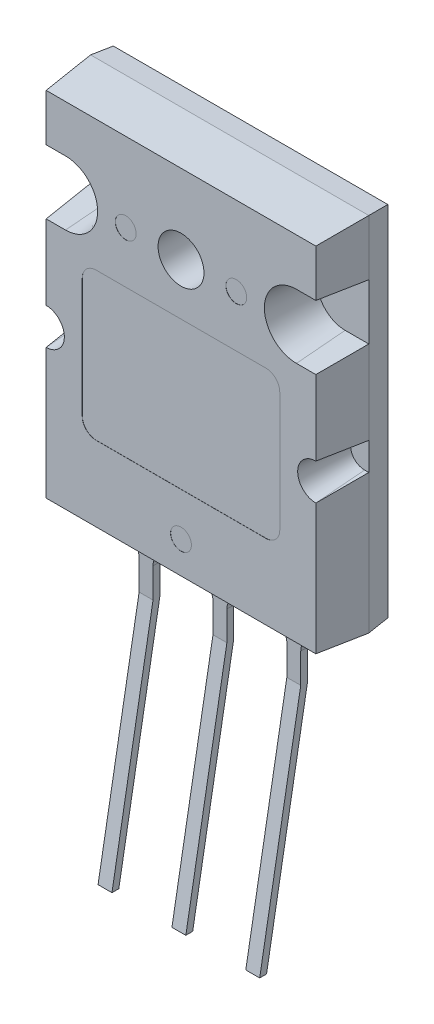
from build123d import *

# Parameters (mm, degrees)
SKETCH1_W                    = 20
SKETCH1_H                    = 26
BOSS_EXTRUDE1_DEPTH          = 1.5
BOSS_EXTRUDE1_DRAFT          = -5
SKETCH1_2_W                  = 20
SKETCH1_2_H                  = 26
BOSS_EXTRUDE2_DEPTH          = 3.5
BOSS_EXTRUDE2_TAPER          = 5
CUT_EXTRUDE1_DEPTH           = 3.5
CUT_EXTRUDE1_TAPER           = -5
CUT_EXTRUDE1_2_DEPTH         = 3.5
CUT_EXTRUDE1_2_TAPER         = -5
CUT_EXTRUDE1_3_DEPTH         = 3.5
CUT_EXTRUDE1_3_TAPER         = -5
CUT_EXTRUDE1_4_DEPTH         = 3.5
CUT_EXTRUDE1_4_TAPER         = -5
CUT_EXTRUDE3_DEPTH           = 17.770509989
CUT_EXTRUDE3_DEPTH_BACK      = 17.770509989
SKETCH5_5_R                  = 1.65
CUT_EXTRUDE4_START           = 3.5
SKETCH5_8_R                  = 0.75
CUT_EXTRUDE4_DEPTH           = 0.01
CUT_EXTRUDE5_START           = -1.5
SKETCH5_9_R                  = 1
CUT_EXTRUDE5_DEPTH           = 1
CUT_EXTRUDE5_DRAFT           = 30
CUT_EXTRUDE5_PROFILE_2_DEPTH = 1
CUT_EXTRUDE5_PROFILE_2_DRAFT = 30
SKETCH6_R                    = 3.5
CUT_EXTRUDE6_DEPTH           = 0.0001
SKETCH7_W                    = 3
SKETCH7_H                    = 0.56
SKETCH7_W_2                  = 2.5
BOSS_EXTRUDE3_DEPTH          = 2.1
SKETCH8_W                    = 1
SKETCH8_H                    = 0.493588666
BOSS_EXTRUDE4_DEPTH          = 18
FILLET1_R                    = 1
CUT_EXTRUDE7_DEPTH           = 35.508424571
CUT_EXTRUDE7_DEPTH_BACK      = 35.508424571
SKETCH9_W                    = 11.62
SKETCH9_H                    = 15
SKETCH12_W                   = 1
SKETCH12_H                   = 0.493286698
BOSS_EXTRUDE5_DEPTH          = 17


# Read off the part's stored shape, not the designer's step: Cut-Extrude1
with BuildPart() as part:
    # Sketch1 → Boss-Extrude1 (with draft: the straight prism first)
    with BuildSketch(Plane.XY):
        Rectangle(SKETCH1_W, SKETCH1_H)
    extrude(amount=-BOSS_EXTRUDE1_DEPTH)
    # Boss-Extrude1: the draft: its side faces are tilted about the plane it starts from
    boss_extrude1_sides = [part.faces().sort_by_distance(p)[0] for p in [
        (-10, 0, -0.75),
        (0, -13, -0.75),
        (10, 0, -0.75),
        (0, 13, -0.75),
    ]]
    draft(boss_extrude1_sides, Plane.XY, BOSS_EXTRUDE1_DRAFT)

    # Sketch1<2> → Boss-Extrude2 (add)
    with BuildSketch(Plane.XY):
        Rectangle(SKETCH1_2_W, SKETCH1_2_H)
    extrude(amount=BOSS_EXTRUDE2_DEPTH, taper=BOSS_EXTRUDE2_TAPER)

    # Cut-Extrude1 outline → Cut-Extrude1 (cut)
    with BuildSketch(Plane.XY):
        with BuildLine():
            Line((10, -1), (9.693789678, -1))
            ThreePointArc((9.693789678, -1), (8.693789678, -2), (9.693789678, -3))
            Line((9.693789678, -3), (10, -3))
            Line((10, -3), (10, -1))
        make_face()
    extrude(amount=CUT_EXTRUDE1_DEPTH, taper=CUT_EXTRUDE1_TAPER, mode=Mode.SUBTRACT)

    # Cut-Extrude1 2 outline → Cut-Extrude1 2 (cut)
    with BuildSketch(Plane.XY):
        with BuildLine():
            Line((-9.693789678, -1), (-10, -1))
            Line((-10, -1), (-10, -3))
            Line((-10, -3), (-9.693789678, -3))
            ThreePointArc((-9.693789678, -3), (-8.693789678, -2), (-9.693789678, -1))
        make_face()
    extrude(amount=CUT_EXTRUDE1_2_DEPTH, taper=CUT_EXTRUDE1_2_TAPER, mode=Mode.SUBTRACT)

    # Cut-Extrude1 3 outline → Cut-Extrude1 3 (cut)
    with BuildSketch(Plane.XY):
        with BuildLine():
            Line((-8.3, 9), (-10, 9))
            Line((-10, 9), (-10, 5))
            Line((-10, 5), (-8.3, 5))
            ThreePointArc((-8.3, 5), (-6.3, 7), (-8.3, 9))
        make_face()
    extrude(amount=CUT_EXTRUDE1_3_DEPTH, taper=CUT_EXTRUDE1_3_TAPER, mode=Mode.SUBTRACT)

    # Cut-Extrude1 4 outline → Cut-Extrude1 4 (cut)
    with BuildSketch(Plane.XY):
        with BuildLine():
            Line((10, 9), (8.3, 9))
            ThreePointArc((8.3, 9), (6.3, 7), (8.3, 5))
            Line((8.3, 5), (10, 5))
            Line((10, 5), (10, 9))
        make_face()
    extrude(amount=CUT_EXTRUDE1_4_DEPTH, taper=CUT_EXTRUDE1_4_TAPER, mode=Mode.SUBTRACT)

    # Sketch5<5> → Cut-Extrude3 (cut, two sides: drawn at the far end of the back side and taken through both)
    with BuildSketch(Plane.XY.offset(-CUT_EXTRUDE3_DEPTH_BACK)):
        with Locations((0, 7)):
            Circle(SKETCH5_5_R)
    extrude(amount=CUT_EXTRUDE3_DEPTH + CUT_EXTRUDE3_DEPTH_BACK, mode=Mode.SUBTRACT)

    # Sketch5<8> → Cut-Extrude4 (cut)
    with BuildSketch(Plane.XY.offset(CUT_EXTRUDE4_START)):
        with Locations((3.975, 7)):
            Circle(SKETCH5_8_R)
        with Locations((-3.975, 7)):
            Circle(SKETCH5_8_R)
        with Locations((0, -10.4)):
            Circle(SKETCH5_8_R)
        with BuildLine():
            Line((-6.1, 3.3), (6.1, 3.3))
            ThreePointArc((6.1, 3.3), (6.807106781, 3.007106781), (7.1, 2.3))
            Line((7.1, 2.3), (7.1, -6.3))
            ThreePointArc((7.1, -6.3), (6.807106781, -7.007106781), (6.1, -7.3))
            Line((6.1, -7.3), (-6.1, -7.3))
            ThreePointArc((-6.1, -7.3), (-6.807106781, -7.007106781), (-7.1, -6.3))
            Line((-7.1, -6.3), (-7.1, 2.3))
            ThreePointArc((-7.1, 2.3), (-6.807106781, 3.007106781), (-6.1, 3.3))
        make_face()
    extrude(amount=-CUT_EXTRUDE4_DEPTH, mode=Mode.SUBTRACT)


with BuildPart() as cut_extrude5_tool:
    # Sketch5<9> → Cut-Extrude5 (with draft: the straight prism first)
    with BuildSketch(Plane.XY.offset(CUT_EXTRUDE5_START)):
        with Locations((8.3, 7)):
            Circle(SKETCH5_9_R)
    extrude(amount=CUT_EXTRUDE5_DEPTH)
    # Cut-Extrude5: the draft: its side faces are tilted about the plane it starts from
    cut_extrude5_sides = [cut_extrude5_tool.faces().sort_by_distance(p)[0] for p in [
        (7.3, 7, -1),
    ]]
    draft(cut_extrude5_sides, Plane.XY.offset(CUT_EXTRUDE5_START), CUT_EXTRUDE5_DRAFT)


with BuildPart() as part_1:
    add(part.part)

    # Cut-Extrude5: cut by cut_extrude5_tool
    add(cut_extrude5_tool.part, mode=Mode.SUBTRACT)


with BuildPart() as cut_extrude5_profile_2_tool:
    # Sketch5<9> → Cut-Extrude5 profile 2 (with draft: the straight prism first)
    with BuildSketch(Plane.XY.offset(CUT_EXTRUDE5_START)):
        with Locations((-8.3, 7)):
            Circle(SKETCH5_9_R)
    extrude(amount=CUT_EXTRUDE5_PROFILE_2_DEPTH)
    # Cut-Extrude5 profile 2: the draft: its side faces are tilted about the plane it starts from
    cut_extrude5_profile_2_sides = [cut_extrude5_profile_2_tool.faces().sort_by_distance(p)[0] for p in [
        (-9.3, 7, -1),
    ]]
    draft(cut_extrude5_profile_2_sides, Plane.XY.offset(CUT_EXTRUDE5_START), CUT_EXTRUDE5_PROFILE_2_DRAFT)


with BuildPart() as part_2:
    add(part_1.part)

    # Cut-Extrude5 profile 2: cut by cut_extrude5_profile_2_tool
    add(cut_extrude5_profile_2_tool.part, mode=Mode.SUBTRACT)

    # Sketch6 → Cut-Extrude6 (cut)
    with BuildSketch(Plane(origin=(0, 0, -1.5), x_dir=(-1, 0, 0), z_dir=(0, 0, -1))):
        with BuildLine():
            Line((-5.427124344, 11.5), (5.427124344, 11.5))
            ThreePointArc((5.427124344, 11.5), (6.75, 12), (8.072875656, 11.5))
            Line((8.072875656, 11.5), (9, 10.578427125))
            Line((9, 10.578427125), (9, 8.5))
            ThreePointArc((9, 8.5), (7.3, 7), (9, 5.5))
            Line((9, 5.5), (9, -9))
            Line((9, -9), (-9, -9))
            Line((-9, -9), (-9, 5.5))
            ThreePointArc((-9, 5.5), (-7.3, 7), (-9, 8.5))
            Line((-9, 8.5), (-9, 10.578427125))
            Line((-9, 10.578427125), (-8.164213562, 11.414213562))
            ThreePointArc((-8.164213562, 11.414213562), (-6.812653663, 11.999018389), (-5.427124344, 11.5))
        make_face()
        with Locations((0, 7)):
            Circle(SKETCH6_R, mode=Mode.SUBTRACT)
    extrude(amount=-CUT_EXTRUDE6_DEPTH, mode=Mode.SUBTRACT)

    # Sketch7 → Boss-Extrude3 (add, along a direction that is not the sketch's normal)
    with BuildSketch(Plane(origin=(0, -12.800597138, 0.447962854), x_dir=(-1, 0, 0), z_dir=(0, -0.9993882205697596, 0.034974055904479696))):
        with Locations((0, 0.026094538)):
            Rectangle(SKETCH7_W, SKETCH7_H)
        with Locations((-5.31, 0.026094538)):
            Rectangle(SKETCH7_W_2, SKETCH7_H)
        with Locations((5.31, 0.026094538)):
            Rectangle(SKETCH7_W_2, SKETCH7_H)
    extrude(amount=BOSS_EXTRUDE3_DEPTH, dir=(0, -1, 0))

    # Sketch8 → Boss-Extrude4 (add, along a direction that is not the sketch's normal)
    with BuildSketch(Plane(origin=(0, -14.89802845, 0.521363439), x_dir=(1, 0, 0), z_dir=(0, -0.9993882205697596, 0.03497405590447946))):
        with Locations((5.31, -0.066334388)):
            Rectangle(SKETCH8_W, SKETCH8_H)
        with Locations((0, -0.066334388)):
            Rectangle(SKETCH8_W, SKETCH8_H)
        with Locations((-5.31, -0.066334388)):
            Rectangle(SKETCH8_W, SKETCH8_H)
    extrude(amount=BOSS_EXTRUDE4_DEPTH, dir=(0, -1, 0))

    # Fillet1
    # the kernel refuses this fillet: 1 mm, written as the material it adds along each edge
    with BuildSketch(Plane(origin=(4.81, -14.993638542, -2.210707425), x_dir=(-1, 0, 0), z_dir=(0, 0.03497405590447946, 0.9993882205697596))) as fillet1_piece_1_section:
        with BuildLine():
            CenterArc((1, 0.968245837), FILLET1_R, 180, 75.522487814)
            Line((0, 0.968245837), (-0.02, 0.968245837))
            Line((-0.02, 0.968245837), (-0.02, 0))
            Line((-0.02, 0), (0, -0.02))
            ThreePointArc((0, -0.02), (0.375, -0.02), (0.745, -0.019364917))
            Line((0.745, -0.019364917), (0.75, 0))
        make_face()
    fillet1_piece_1 = extrude(amount=5.334817848, mode=Mode.PRIVATE)
    fillet1_piece_1 = split(fillet1_piece_1, bisect_by=Plane(origin=(4.620408244, -15.128632193, 0.701712982), z_dir=(0, 0, -1)), keep=Keep.TOP, mode=Mode.PRIVATE)
    fillet1_piece_1 = split(fillet1_piece_1, bisect_by=Plane(origin=(4.620408244, -15.128632193, 0.208426284), z_dir=(0, 0, 1)), keep=Keep.TOP, mode=Mode.PRIVATE)
    add(fillet1_piece_1)
    with BuildSketch(Plane(origin=(5.81, -14.807058324, 3.120846692), x_dir=(1, 0, 0), z_dir=(0, -0.03497405590447946, -0.9993882205697596))) as fillet1_piece_2_section:
        with BuildLine():
            CenterArc((1, 0.968245837), FILLET1_R, 180, 75.522487814)
            Line((0, 0.968245837), (-0.02, 0.968245837))
            Line((-0.02, 0.968245837), (-0.02, 0))
            Line((-0.02, 0), (0, -0.02))
            ThreePointArc((0, -0.02), (0.375, -0.02), (0.745, -0.019364917))
            Line((0.745, -0.019364917), (0.75, 0))
        make_face()
    fillet1_piece_2 = extrude(amount=5.334817848, mode=Mode.PRIVATE)
    fillet1_piece_2 = split(fillet1_piece_2, bisect_by=Plane(origin=(5.999591756, -15.128632193, 0.701712982), z_dir=(0, 0, -1)), keep=Keep.TOP, mode=Mode.PRIVATE)
    fillet1_piece_2 = split(fillet1_piece_2, bisect_by=Plane(origin=(5.999591756, -15.128632193, 0.208426284), z_dir=(0, 0, 1)), keep=Keep.TOP, mode=Mode.PRIVATE)
    add(fillet1_piece_2)
    with BuildSketch(Plane(origin=(0.5, -14.996414972, -2.290044267), x_dir=(1, 0, 0), z_dir=(0, 0.03497405590447946, 0.9993882205697596))) as fillet1_piece_3_section:
        with BuildLine():
            CenterArc((FILLET1_R, -FILLET1_R), FILLET1_R, 90, 90)
            Line((0, -FILLET1_R), (-FILLET1_R * 0.02, -FILLET1_R))
            Line((-FILLET1_R * 0.02, -FILLET1_R), (-FILLET1_R * 0.02, FILLET1_R * 0.02))
            Line((-FILLET1_R * 0.02, FILLET1_R * 0.02), (FILLET1_R, FILLET1_R * 0.02))
            Line((FILLET1_R, FILLET1_R * 0.02), (FILLET1_R, 0))
        make_face()
    fillet1_piece_3 = extrude(amount=5.493588666, mode=Mode.PRIVATE)
    fillet1_piece_3 = split(fillet1_piece_3, bisect_by=Plane(origin=(0.726395114, -15.126882136, 0.701712982), z_dir=(0, 0, -1)), keep=Keep.TOP, mode=Mode.PRIVATE)
    fillet1_piece_3 = split(fillet1_piece_3, bisect_by=Plane(origin=(0.726395114, -15.126882136, 0.208426284), z_dir=(0, 0, 1)), keep=Keep.TOP, mode=Mode.PRIVATE)
    add(fillet1_piece_3)
    with BuildSketch(Plane(origin=(-0.5, -14.804281894, 3.200183534), x_dir=(-1, 0, 0), z_dir=(0, -0.03497405590447946, -0.9993882205697596))) as fillet1_piece_4_section:
        with BuildLine():
            CenterArc((FILLET1_R, -FILLET1_R), FILLET1_R, 90, 90)
            Line((0, -FILLET1_R), (-FILLET1_R * 0.02, -FILLET1_R))
            Line((-FILLET1_R * 0.02, -FILLET1_R), (-FILLET1_R * 0.02, FILLET1_R * 0.02))
            Line((-FILLET1_R * 0.02, FILLET1_R * 0.02), (FILLET1_R, FILLET1_R * 0.02))
            Line((FILLET1_R, FILLET1_R * 0.02), (FILLET1_R, 0))
        make_face()
    fillet1_piece_4 = extrude(amount=5.493588666, mode=Mode.PRIVATE)
    fillet1_piece_4 = split(fillet1_piece_4, bisect_by=Plane(origin=(-0.726395114, -15.126882136, 0.701712982), z_dir=(0, 0, -1)), keep=Keep.TOP, mode=Mode.PRIVATE)
    fillet1_piece_4 = split(fillet1_piece_4, bisect_by=Plane(origin=(-0.726395114, -15.126882136, 0.208426284), z_dir=(0, 0, 1)), keep=Keep.TOP, mode=Mode.PRIVATE)
    add(fillet1_piece_4)
    with BuildSketch(Plane(origin=(-5.81, -14.993638542, -2.210707425), x_dir=(-1, 0, 0), z_dir=(0, 0.03497405590447946, 0.9993882205697596))) as fillet1_piece_5_section:
        with BuildLine():
            CenterArc((1, 0.968245837), FILLET1_R, 180, 75.522487814)
            Line((0, 0.968245837), (-0.02, 0.968245837))
            Line((-0.02, 0.968245837), (-0.02, 0))
            Line((-0.02, 0), (0, -0.02))
            ThreePointArc((0, -0.02), (0.375, -0.02), (0.745, -0.019364917))
            Line((0.745, -0.019364917), (0.75, 0))
        make_face()
    fillet1_piece_5 = extrude(amount=5.334817848, mode=Mode.PRIVATE)
    fillet1_piece_5 = split(fillet1_piece_5, bisect_by=Plane(origin=(-5.999591756, -15.128632193, 0.701712982), z_dir=(0, 0, -1)), keep=Keep.TOP, mode=Mode.PRIVATE)
    fillet1_piece_5 = split(fillet1_piece_5, bisect_by=Plane(origin=(-5.999591756, -15.128632193, 0.208426284), z_dir=(0, 0, 1)), keep=Keep.TOP, mode=Mode.PRIVATE)
    add(fillet1_piece_5)
    with BuildSketch(Plane(origin=(-4.81, -14.807058324, 3.120846692), x_dir=(1, 0, 0), z_dir=(0, -0.03497405590447946, -0.9993882205697596))) as fillet1_piece_6_section:
        with BuildLine():
            CenterArc((1, 0.968245837), FILLET1_R, 180, 75.522487814)
            Line((0, 0.968245837), (-0.02, 0.968245837))
            Line((-0.02, 0.968245837), (-0.02, 0))
            Line((-0.02, 0), (0, -0.02))
            ThreePointArc((0, -0.02), (0.375, -0.02), (0.745, -0.019364917))
            Line((0.745, -0.019364917), (0.75, 0))
        make_face()
    fillet1_piece_6 = extrude(amount=5.334817848, mode=Mode.PRIVATE)
    fillet1_piece_6 = split(fillet1_piece_6, bisect_by=Plane(origin=(-4.620408244, -15.128632193, 0.701712982), z_dir=(0, 0, -1)), keep=Keep.TOP, mode=Mode.PRIVATE)
    fillet1_piece_6 = split(fillet1_piece_6, bisect_by=Plane(origin=(-4.620408244, -15.128632193, 0.208426284), z_dir=(0, 0, 1)), keep=Keep.TOP, mode=Mode.PRIVATE)
    add(fillet1_piece_6)

    # Sketch9 → Cut-Extrude7 (cut, two sides: drawn at the far end of the back side and taken through both)
    with BuildSketch(Plane.XY.offset(0.701712982).offset(-CUT_EXTRUDE7_DEPTH_BACK)):
        with Locations((0, -25.5)):
            Rectangle(SKETCH9_W, SKETCH9_H)
    extrude(amount=CUT_EXTRUDE7_DEPTH + CUT_EXTRUDE7_DEPTH_BACK, mode=Mode.SUBTRACT)

    # Sketch12 → Boss-Extrude5 (add, along a direction that is not the sketch's normal)
    with BuildSketch(Plane.XZ.offset(18)):
        with Locations((5.31, 0.455069633)):
            Rectangle(SKETCH12_W, SKETCH12_H)
        with Locations((0, 0.455069633)):
            Rectangle(SKETCH12_W, SKETCH12_H)
        with Locations((-5.31, 0.455069633)):
            Rectangle(SKETCH12_W, SKETCH12_H)
    extrude(amount=BOSS_EXTRUDE5_DEPTH, dir=(0, -0.984807753012208, 0.17364817766693055))


solid = part_2.part
